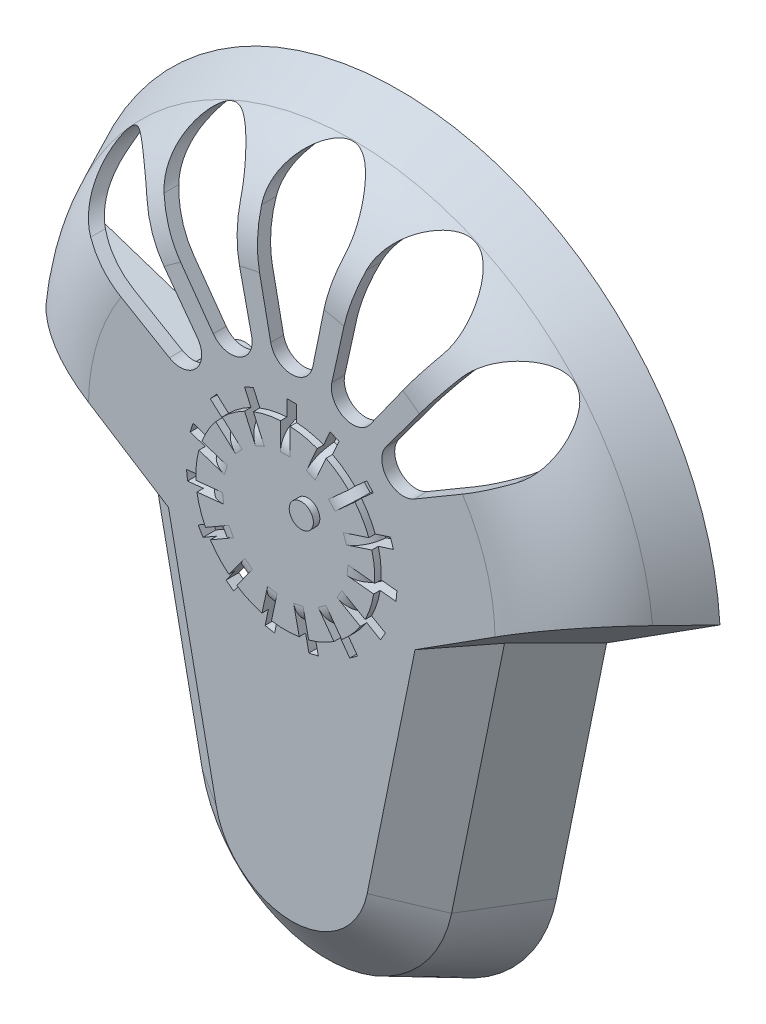
from build123d import *
from OCP.BRepFilletAPI import BRepFilletAPI_MakeChamfer

# Parameters (mm, degrees)
BOSS_EXTRUDE1_DEPTH      = 12.7
BOSS_EXTRUDE1_DRAFT      = 25
FILLET1_R                = 12.7
CHAMFER1_SIZE            = 4.5974
CHAMFER1_SIZE2           = 4.007661149
SHELL1_T                 = -1.524
CUT_EXTRUDE1_DEPTH       = 81.542298115
CIRPATTERN1_COUNT        = 3
CIRPATTERN1_ANGLE        = 48
MIRROR1_COPY_1_DEPTH     = 81.542298115
MIRROR1_COPY_2_DEPTH     = 81.542298115
MIRROR1_COPY_3_DEPTH     = 81.542298115
SKETCH3_R                = 10.6045
BOSS_EXTRUDE2_DEPTH      = 0.762
SKETCH4_W                = 1.14365377
SKETCH4_H                = 2.54
CUT_EXTRUDE2_DEPTH       = 81.665960791
FILLET2_R                = 2.54
CIRPATTERN2_COUNT        = 15
FILLET2_OF_CIRPATTERN2_R = 2.54
SKETCH5_R                = 1.432482426
BOSS_EXTRUDE3_DEPTH      = 0.762
SKETCH6_R                = 7.62
SKETCH6_R_2              = 6.35
BOSS_EXTRUDE4_DEPTH      = 2.54
SKETCH7_R                = 2.2225
BOSS_EXTRUDE5_DEPTH      = 9.525
SKETCH8_R                = 1.305060507
CUT_EXTRUDE3_DEPTH       = 2.54
RIB3_REACH               = 82.522
SKETCH10_WALLS_W         = 174.968432376
SKETCH10_WALLS_H         = 1.27
SKETCH10_WALLS_W_2       = 1.27
SKETCH10_WALLS_H_2       = 174.684443395


with BuildPart() as part:
    # Sketch1 → Boss-Extrude1 (with draft: the straight prism first)
    with BuildSketch(Plane.XY):
        with BuildLine():
            ThreePointArc((-18.667565623, -3.797959151), (0, -19.05), (18.667565623, -3.797959151))
            Line((18.667565623, -3.797959151), (24.607957551, 25.4))
            Line((24.607957551, 25.4), (38.036157378, 33.954706766))
            ThreePointArc((38.036157378, 33.954706766), (0, 69.85), (-38.036157378, 33.954706766))
            Line((-38.036157378, 33.954706766), (-24.607957551, 25.4))
            Line((-24.607957551, 25.4), (-18.667565623, -3.797959151))
        make_face()
    extrude(amount=BOSS_EXTRUDE1_DEPTH)
    # Boss-Extrude1: the draft: its side faces are tilted about the plane it starts from
    boss_extrude1_sides = [part.faces().sort_by_distance(p)[0] for p in [
        (-31.322057464, 29.677353383, 6.35),
        (-21.637761587, 10.801020425, 6.35),
        (0, -19.05, 6.35),
        (21.637761587, 10.801020425, 6.35),
        (31.322057464, 29.677353383, 6.35),
        (0, 69.85, 6.35),
    ]]
    draft(boss_extrude1_sides, Plane.XY, BOSS_EXTRUDE1_DRAFT)

    # Fillet1
    fillet1_edges = [part.edges().sort_by_distance(p)[0] for p in [
        (0, 63.927892741, 12.7),
    ]]
    fillet(fillet1_edges, radius=FILLET1_R)

    # Chamfer1: one chamfer whose edges measure the first distance from different faces: ONE call of the kernel's chamfer builder (chamfer() names one face for all edges)
    chamfer1_edges_1 = [part.edges().sort_by_distance(p)[0] for p in [
        (-16.085126481, 13.213358919, 12.7),
    ]]
    chamfer1_side_1 = [part.faces().sort_by_distance(p)[0] for p in [
        (-18.823986233, 12.023463188, 6.435673569),
    ]]
    chamfer1_edges_2 = [part.edges().sort_by_distance(p)[0] for p in [
        (0, -13.127892741, 12.7),
    ]]
    chamfer1_side_2 = [part.faces().sort_by_distance(p)[0] for p in [
        (0, -16.088946371, 6.35),
    ]]
    chamfer1_edges_3 = [part.edges().sort_by_distance(p)[0] for p in [
        (16.085126481, 13.213358919, 12.7),
    ]]
    chamfer1_side_3 = [part.faces().sort_by_distance(p)[0] for p in [
        (18.823986233, 12.023463188, 6.435673569),
    ]]
    chamfer1 = BRepFilletAPI_MakeChamfer(part.part.solid().wrapped)
    for e in chamfer1_edges_1:
        chamfer1.Add(CHAMFER1_SIZE, CHAMFER1_SIZE2, e.wrapped, chamfer1_side_1[0].wrapped)  # the first distance lies on this face
    for e in chamfer1_edges_2:
        chamfer1.Add(CHAMFER1_SIZE, CHAMFER1_SIZE2, e.wrapped, chamfer1_side_2[0].wrapped)  # the first distance lies on this face
    for e in chamfer1_edges_3:
        chamfer1.Add(CHAMFER1_SIZE, CHAMFER1_SIZE2, e.wrapped, chamfer1_side_3[0].wrapped)  # the first distance lies on this face
    add(Compound.cast(chamfer1.Shape()), mode=Mode.REPLACE)

    # Shell1
    shell1_openings = [part.faces().sort_by_distance(p)[0] for p in [
        (0, 29.96131976, 0),
    ]]
    offset(amount=SHELL1_T, openings=shell1_openings, kind=Kind.INTERSECTION)

    # Sketch2 → Cut-Extrude1 (cut, through all)
    with BuildSketch(Plane.XY.offset(12.7)):
        with BuildLine():
            Line((-2.488681579, 49.022), (-4.977363157, 61.214))
            ThreePointArc((-4.977363157, 61.214), (0, 67.31), (4.977363157, 61.214))
            Line((4.977363157, 61.214), (2.488681579, 49.022))
            ThreePointArc((2.488681579, 49.022), (0, 46.99), (-2.488681579, 49.022))
        make_face()
    cut_extrude1 = extrude(amount=-CUT_EXTRUDE1_DEPTH, mode=Mode.SUBTRACT)

    # CirPattern1: Cut-Extrude1 ×3 about axis
    cirpattern1_axis = Axis((0, 31.75, 0), (0, 0, -1))
    for i in range(1, CIRPATTERN1_COUNT):
        add(cut_extrude1.rotate(cirpattern1_axis, i * CIRPATTERN1_ANGLE / (CIRPATTERN1_COUNT - 1)), mode=Mode.SUBTRACT)

    # Mirror1 copy 1 sketch → Mirror1 copy 1 (cut, through all)
    with BuildSketch(Plane(origin=(12.913888418, 2.74493172, 12.7), x_dir=(-0.9135454576426005, -0.40673664307580093, 0), z_dir=(0, 0, 1))):
        with BuildLine():
            Line((-2.488681579, -49.022), (-4.977363157, -61.214))
            ThreePointArc((-4.977363157, -61.214), (0, -67.31), (4.977363157, -61.214))
            Line((4.977363157, -61.214), (2.488681579, -49.022))
            ThreePointArc((2.488681579, -49.022), (0, -46.99), (-2.488681579, -49.022))
        make_face()
    extrude(amount=-MIRROR1_COPY_1_DEPTH, mode=Mode.SUBTRACT)

    # Mirror1 copy 2 sketch → Mirror1 copy 2 (cut, through all)
    with BuildSketch(Plane(origin=(23.594848209, 10.505103248, 12.7), x_dir=(-0.669130606358857, -0.7431448254773954, 0), z_dir=(0, 0, 1))):
        with BuildLine():
            Line((-2.488681579, -49.022), (-4.977363157, -61.214))
            ThreePointArc((-4.977363157, -61.214), (0, -67.31), (4.977363157, -61.214))
            Line((4.977363157, -61.214), (2.488681579, -49.022))
            ThreePointArc((2.488681579, -49.022), (0, -46.99), (-2.488681579, -49.022))
        make_face()
    extrude(amount=-MIRROR1_COPY_2_DEPTH, mode=Mode.SUBTRACT)

    # Mirror1 copy 3 sketch → Mirror1 copy 3 (cut, through all)
    with BuildSketch(Plane(origin=(0, 0, 12.7), x_dir=(-1, 0, 0), z_dir=(0, 0, 1))):
        with BuildLine():
            Line((-2.488681579, -49.022), (-4.977363157, -61.214))
            ThreePointArc((-4.977363157, -61.214), (0, -67.31), (4.977363157, -61.214))
            Line((4.977363157, -61.214), (2.488681579, -49.022))
            ThreePointArc((2.488681579, -49.022), (0, -46.99), (-2.488681579, -49.022))
        make_face()
    extrude(amount=-MIRROR1_COPY_3_DEPTH, mode=Mode.SUBTRACT)

    # Sketch3 → Boss-Extrude2 (add)
    with BuildSketch(Plane.XY.offset(12.7)):
        with Locations(Location((0, 31.75, 0), (0, 0, 180))):
            Circle(SKETCH3_R)
    extrude(amount=BOSS_EXTRUDE2_DEPTH)

    # Sketch4 → Cut-Extrude2 (cut, through all)
    with BuildSketch(Plane.XY.offset(13.462)):
        with Locations((0, 42.955990566)):
            Rectangle(SKETCH4_W, SKETCH4_H)
    cut_extrude2 = extrude(amount=-CUT_EXTRUDE2_DEPTH, mode=Mode.SUBTRACT)

    # Fillet2
    # the kernel refuses this fillet: 2.54 mm, written as the material it takes off along each edge
    with BuildSketch(Plane(origin=(0.571826885, 41.685990566, 13.462), x_dir=(0, 0, -1), z_dir=(-1, 0, 0))) as fillet2_piece_1:
        with BuildLine():
            CenterArc((2.54, 2.52726809), FILLET2_R, 180, 84.260829523)
            Line((0, 2.52726809), (-0.0508, 2.52726809))
            Line((-0.0508, 2.52726809), (-0.0508, 0))
            Line((-0.0508, 0), (0, -0.0508))
            ThreePointArc((0, -0.0508), (1.143, -0.0508), (2.28092, -0.050545362))
            Line((2.28092, -0.050545362), (2.286, 0))
        make_face()
    extrude(amount=1.143653769, mode=Mode.SUBTRACT)

    # CirPattern2: Cut-Extrude2 ×15 about axis
    cirpattern2_axis = Axis((0, 31.75, 0), (0, 0, 1))
    for i in range(1, CIRPATTERN2_COUNT):
        add(cut_extrude2.rotate(cirpattern2_axis, i * 360 / CIRPATTERN2_COUNT), mode=Mode.SUBTRACT)

    # Fillet2 of CirPattern2
    # the kernel refuses this fillet: 2.54 mm, written as the material it takes off along each edge
    with BuildSketch(Plane(origin=(-3.518941595, 41.059561996, 13.462), x_dir=(0.4067366430758002, -0.9135454576426009, 0), z_dir=(-0.913545457642601, -0.40673664307580026, 0)), Plane(origin=(-7.001253105, 38.823425582, 13.462), x_dir=(0.7431448254773942, -0.6691306063588583, 0), z_dir=(-0.6691306063588582, -0.7431448254773942, 0)), Plane(origin=(-9.272984348, 35.364229626, 13.462), x_dir=(0.9510565162951536, -0.30901699437494745, 0), z_dir=(-0.3090169943749475, -0.9510565162951536, 0)), Plane(origin=(-9.941332355, 31.280100532, 13.462), x_dir=(0.9945218953682734, 0.10452846326765355, 0), z_dir=(0.10452846326765354, -0.9945218953682734, 0)), Plane(origin=(-8.890733684, 27.277221326, 13.462), x_dir=(0.8660254037844388, 0.49999999999999983, 0), z_dir=(0.49999999999999983, -0.8660254037844388, 0)), Plane(origin=(-6.302846389, 24.047726186, 13.462), x_dir=(0.5877852522924731, 0.8090169943749473, 0), z_dir=(0.8090169943749475, -0.5877852522924732, 0)), Plane(origin=(-2.625139694, 22.150024162, 13.462), x_dir=(0.20791169081775931, 0.9781476007338057, 0), z_dir=(0.9781476007338057, -0.20791169081775931, 0)), Plane(origin=(1.506477503, 21.912245173, 13.462), x_dir=(-0.20791169081775954, 0.9781476007338057, 0), z_dir=(0.9781476007338057, 0.2079116908177595, 0)), Plane(origin=(5.377611054, 23.375503367, 13.462), x_dir=(-0.5877852522924731, 0.8090169943749473, 0), z_dir=(0.8090169943749476, 0.5877852522924731, 0)), Plane(origin=(8.318906799, 26.286788108, 13.462), x_dir=(-0.8660254037844383, 0.5000000000000003, 0), z_dir=(0.5000000000000004, 0.8660254037844384, 0)), Plane(origin=(9.821787984, 30.142711818, 13.462), x_dir=(-0.9945218953682734, 0.1045284632676533, 0), z_dir=(0.1045284632676533, 0.9945218953682734, 0)), Plane(origin=(9.626392799, 34.276550256, 13.462), x_dir=(-0.9510565162951536, -0.3090169943749472, 0), z_dir=(-0.30901699437494723, 0.9510565162951536, 0)), Plane(origin=(7.766506845, 37.973525202, 13.462), x_dir=(-0.7431448254773946, -0.6691306063588578, 0), z_dir=(-0.6691306063588579, 0.7431448254773947, 0)), Plane(origin=(4.563721301, 40.594396101, 13.462), x_dir=(-0.4067366430758001, -0.9135454576426009, 0), z_dir=(-0.913545457642601, 0.40673664307580015, 0))) as fillet2_of_cirpattern2_piece_1:
        with BuildLine():
            CenterArc((2.52726809, -2.54), FILLET2_OF_CIRPATTERN2_R, 90, 84.260829523)
            Line((0, -2.286), (-0.050545362, -2.28092))
            ThreePointArc((-0.050545362, -2.28092), (-0.0508, -1.143), (-0.0508, 0))
            Line((-0.0508, 0), (0, 0.0508))
            Line((0, 0.0508), (2.52726809, 0.0508))
            Line((2.52726809, 0.0508), (2.52726809, 0))
        make_face()
    extrude(amount=1.143653769, mode=Mode.SUBTRACT)

    # Sketch5 → Boss-Extrude3 (add)
    with BuildSketch(Plane.XY.offset(13.462)):
        with Locations(Location((2.655034567, 34.606356956, 0), (0, 0, 180))):
            Circle(SKETCH5_R)
    extrude(amount=BOSS_EXTRUDE3_DEPTH)

    # Sketch6 → Boss-Extrude4 (add)
    with BuildSketch(Plane(origin=(0, 0, 11.176), x_dir=(-1, 0, 0), z_dir=(0, 0, -1))):
        with Locations(Location((0, 31.75, 0), (0, 0, 180))):
            Circle(SKETCH6_R)
        with Locations((0, 31.75)):
            Circle(SKETCH6_R_2, mode=Mode.SUBTRACT)
    extrude(amount=BOSS_EXTRUDE4_DEPTH)

    # Sketch7 → Boss-Extrude5 (add)
    with BuildSketch(Plane(origin=(0, 0, 11.176), x_dir=(-1, 0, 0), z_dir=(0, 0, -1))):
        with Locations(Location((0, 0, 0), (0, 0, 180))):
            Circle(SKETCH7_R)
        with Locations(Location((-16.57718947, 34.273599514, 0), (0, 0, 180))):
            Circle(SKETCH7_R)
        with Locations(Location((16.57718947, 34.273599514, 0), (0, 0, 180))):
            Circle(SKETCH7_R)
    extrude(amount=BOSS_EXTRUDE5_DEPTH)

    # Sketch8 → Cut-Extrude3 (cut)
    with BuildSketch(Plane(origin=(0, 0, 1.651), x_dir=(-1, 0, 0), z_dir=(0, 0, -1))):
        with Locations((-16.57718947, 34.273599514)):
            Circle(SKETCH8_R)
        with Locations((16.57718947, 34.273599514)):
            Circle(SKETCH8_R)
        Circle(SKETCH8_R)
    extrude(amount=-CUT_EXTRUDE3_DEPTH, mode=Mode.SUBTRACT)

    # Sketch10 walls → Rib3 (add, up to next)
    with BuildSketch(Plane(origin=(0, 0, 1.651), x_dir=(-1, 0, 0), z_dir=(0, 0, -1)), mode=Mode.PRIVATE) as rib3_sk1:
        Polygon((-58.480779637, 8.669434566), (110.870795713, 64.720159966), (110.471749053, 65.925838929), (-58.879826297, 9.87511353), align=None)
    rib3_tool1 = extrude(rib3_sk1.sketch, amount=-RIB3_REACH, mode=Mode.PRIVATE) - part.part
    # Sketch10 walls → Rib3 (add, up to next)
    with BuildSketch(Plane(origin=(0, 0, 1.651), x_dir=(-1, 0, 0), z_dir=(0, 0, -1)), mode=Mode.PRIVATE) as rib3_sk2:
        Polygon((58.879826297, 9.87511353), (-110.471749053, 65.925838929), (-110.870795713, 64.720159966), (58.480779637, 8.669434566), align=None)
    rib3_tool2 = extrude(rib3_sk2.sketch, amount=-RIB3_REACH, mode=Mode.PRIVATE) - part.part
    # Sketch10 walls → Rib3 (add, up to next)
    with BuildSketch(Plane(origin=(0, 0, 1.651), x_dir=(-1, 0, 0), z_dir=(0, 0, -1)), mode=Mode.PRIVATE) as rib3_sk3:
        with Locations((8.184345975, 0)):
            Rectangle(SKETCH10_WALLS_W, SKETCH10_WALLS_H)
    rib3_tool3 = extrude(rib3_sk3.sketch, amount=-RIB3_REACH, mode=Mode.PRIVATE) - part.part
    # Sketch10 walls → Rib3 (add, up to next)
    with BuildSketch(Plane(origin=(0, 0, 1.651), x_dir=(-1, 0, 0), z_dir=(0, 0, -1)), mode=Mode.PRIVATE) as rib3_sk4:
        with Locations((0, -8.042351485)):
            Rectangle(SKETCH10_WALLS_W_2, SKETCH10_WALLS_H_2)
    rib3_tool4 = extrude(rib3_sk4.sketch, amount=-RIB3_REACH, mode=Mode.PRIVATE) - part.part
    # Sketch10 walls → Rib3 (add, up to next)
    with BuildSketch(Plane(origin=(0, 0, 1.651), x_dir=(-1, 0, 0), z_dir=(0, 0, -1)), mode=Mode.PRIVATE) as rib3_sk5:
        with Locations((-8.184345975, 0)):
            Rectangle(SKETCH10_WALLS_W, SKETCH10_WALLS_H)
    rib3_tool5 = extrude(rib3_sk5.sketch, amount=-RIB3_REACH, mode=Mode.PRIVATE) - part.part
    add(rib3_tool1.solids().sort_by_distance((-25.995484708, 37.297636748, 1.651))[0])
    add(rib3_tool2.solids().sort_by_distance((25.995484708, 37.297636748, 1.651))[0])
    add(rib3_tool3.solids().sort_by_distance((-8.184345975, 0, 1.651))[0])
    add(rib3_tool4.solids().sort_by_distance((0, -8.042351484, 1.651))[0])
    add(rib3_tool5.solids().sort_by_distance((8.184345975, 0, 1.651))[0])


solid = part.part
